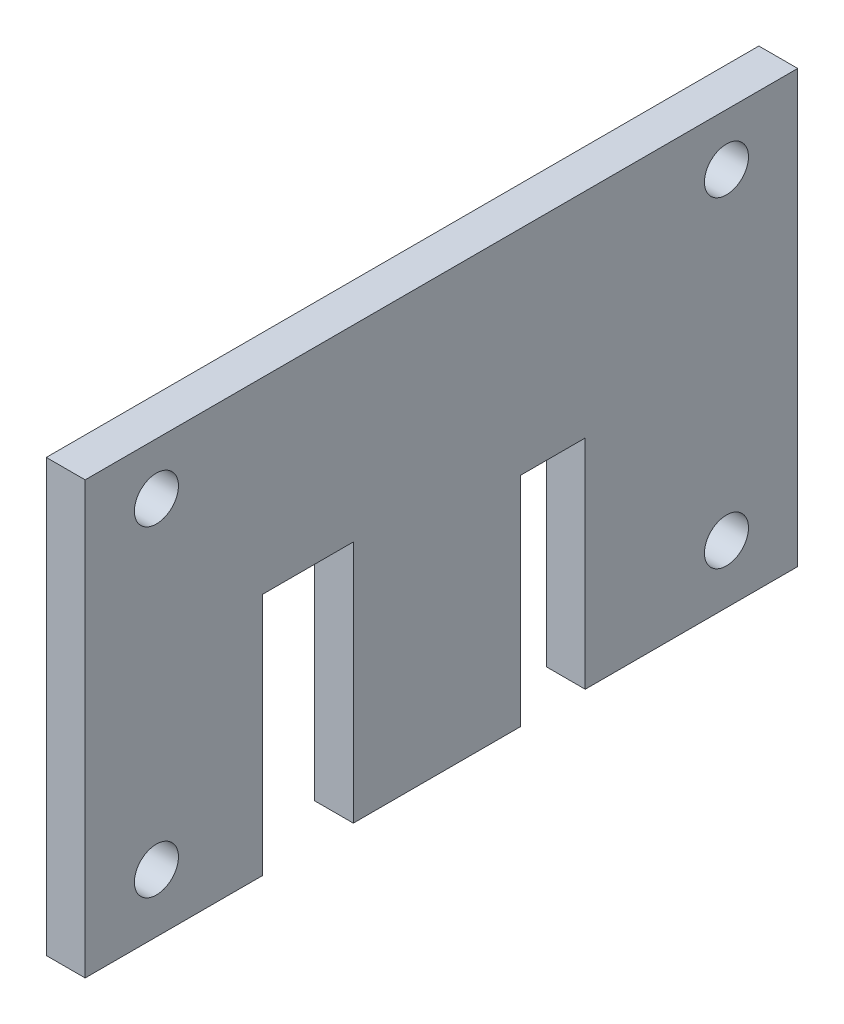
from build123d import *

# Parameters (mm, degrees)
SKETCH1_W           = 55
SKETCH1_H           = 33.3
COVER_PLATE_DEPTH   = 3
SKETCH2_W           = 7
SKETCH2_H           = 19.8
SKETCH2_W_2         = 5
SKETCH2_H_2         = 17.8
CABLE_NOTCHES_DEPTH = 5
SKETCH3_R           = 1.7
SCREW_HOLES_DEPTH   = 5


with BuildPart() as part:
    # Sketch1 → Cover Plate (new body)
    with BuildSketch(Plane(origin=(72.4, 0, 0), x_dir=(0, 0, -1), z_dir=(1, 0, 0))):
        with Locations((-72, -10.15)):
            Rectangle(SKETCH1_W, SKETCH1_H)
    extrude(amount=COVER_PLATE_DEPTH)

    # Sketch2 → Cable Notches (cut)
    with BuildSketch(Plane(origin=(71.4, 0, 0), x_dir=(0, 0, -1), z_dir=(1, 0, 0))):
        with Locations((-82.3, -17.9)):
            Rectangle(SKETCH2_W, SKETCH2_H)
        with Locations((-63.4, -18.9)):
            Rectangle(SKETCH2_W_2, SKETCH2_H_2)
    extrude(amount=CABLE_NOTCHES_DEPTH, mode=Mode.SUBTRACT)

    # Sketch3 → Screw Holes (cut)
    with BuildSketch(Plane(origin=(71.4, 0, 0), x_dir=(0, 0, -1), z_dir=(1, 0, 0))):
        with Locations((-94, -22.3)):
            Circle(SKETCH3_R)
        with Locations((-94, 2.5)):
            Circle(SKETCH3_R)
        with Locations((-50, -22.3)):
            Circle(SKETCH3_R)
        with Locations((-50, 2.5)):
            Circle(SKETCH3_R)
    extrude(amount=SCREW_HOLES_DEPTH, mode=Mode.SUBTRACT)


solid = part.part
